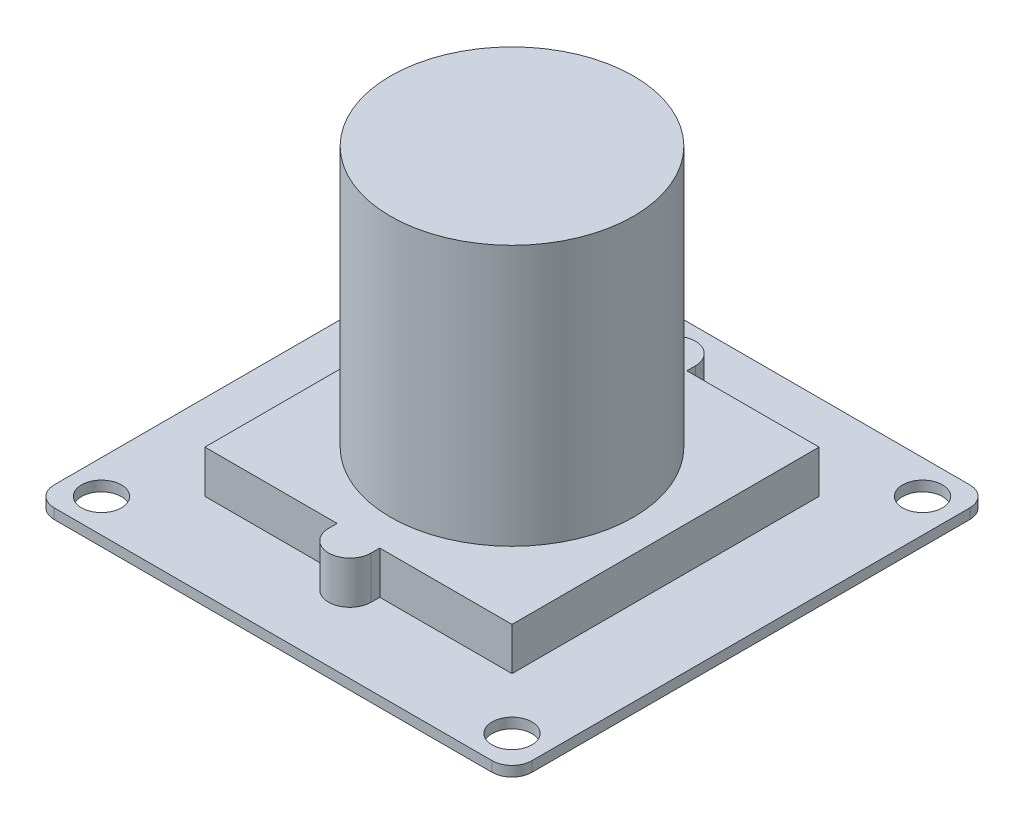
from build123d import *

# Parameters (mm, degrees)
SKETCH1_W           = 32
SKETCH1_H           = 32
BOSS_EXTRUDE1_DEPTH = 0.681
SKETCH2_R           = 1.3335
CUT_EXTRUDE1_DEPTH  = 1
FILLET1_R           = 1.335
BOSS_EXTRUDE2_DEPTH = 2.857
SKETCH4_R           = 8.1405
BOSS_EXTRUDE3_DEPTH = 17.46


with BuildPart() as part:
    # Sketch1 → Boss-Extrude1 (new body)
    with BuildSketch(Plane(origin=(0, 0, 0), x_dir=(1, 0, 0), z_dir=(0, 1, 0))):
        Rectangle(SKETCH1_W, SKETCH1_H)
    extrude(amount=BOSS_EXTRUDE1_DEPTH)

    # Sketch2 → Cut-Extrude1 (cut)
    with BuildSketch(Plane(origin=(0, 0.681, 0), x_dir=(1, 0, 0), z_dir=(0, 1, 0))):
        with Locations((13.75, 13.75)):
            Circle(SKETCH2_R)
        with Locations((-13.75, 13.75)):
            Circle(SKETCH2_R)
        with Locations((-13.75, -13.75)):
            Circle(SKETCH2_R)
        with Locations((13.75, -13.75)):
            Circle(SKETCH2_R)
    extrude(amount=-CUT_EXTRUDE1_DEPTH, mode=Mode.SUBTRACT)

    # Fillet1
    fillet1_edges = [part.edges().sort_by_distance(p)[0] for p in [
        (16, 0.3405, -16),
        (16, 0.3405, 16),
        (-16, 0.3405, 16),
        (-16, 0.3405, -16),
    ]]
    fillet(fillet1_edges, radius=FILLET1_R)

    # Sketch3 → Boss-Extrude2 (add)
    with BuildSketch(Plane(origin=(0, 0.681, 0), x_dir=(1, 0, 0), z_dir=(0, 1, 0))):
        with BuildLine():
            Line((-10.285, 10.285), (-10.285, -10.285))
            Line((-10.285, -10.285), (-1.4285, -10.285))
            Line((-1.4285, -10.285), (-1.4285, -10.857))
            ThreePointArc((-1.4285, -10.857), (0, -12.2855), (1.4285, -10.857))
            Line((1.4285, -10.857), (1.4285, -10.285))
            Line((1.4285, -10.285), (10.285, -10.285))
            Line((10.285, -10.285), (10.285, 10.285))
            Line((10.285, 10.285), (1.4285, 10.285))
            Line((1.4285, 10.285), (1.4285, 10.857))
            ThreePointArc((1.4285, 10.857), (0, 12.2855), (-1.4285, 10.857))
            Line((-1.4285, 10.857), (-1.4285, 10.285))
            Line((-1.4285, 10.285), (-10.285, 10.285))
        make_face()
    extrude(amount=BOSS_EXTRUDE2_DEPTH)

    # Sketch4 → Boss-Extrude3 (add)
    with BuildSketch(Plane(origin=(0, 3.538, 0), x_dir=(1, 0, 0), z_dir=(0, 1, 0))):
        Circle(SKETCH4_R)
    extrude(amount=BOSS_EXTRUDE3_DEPTH)


solid = part.part
